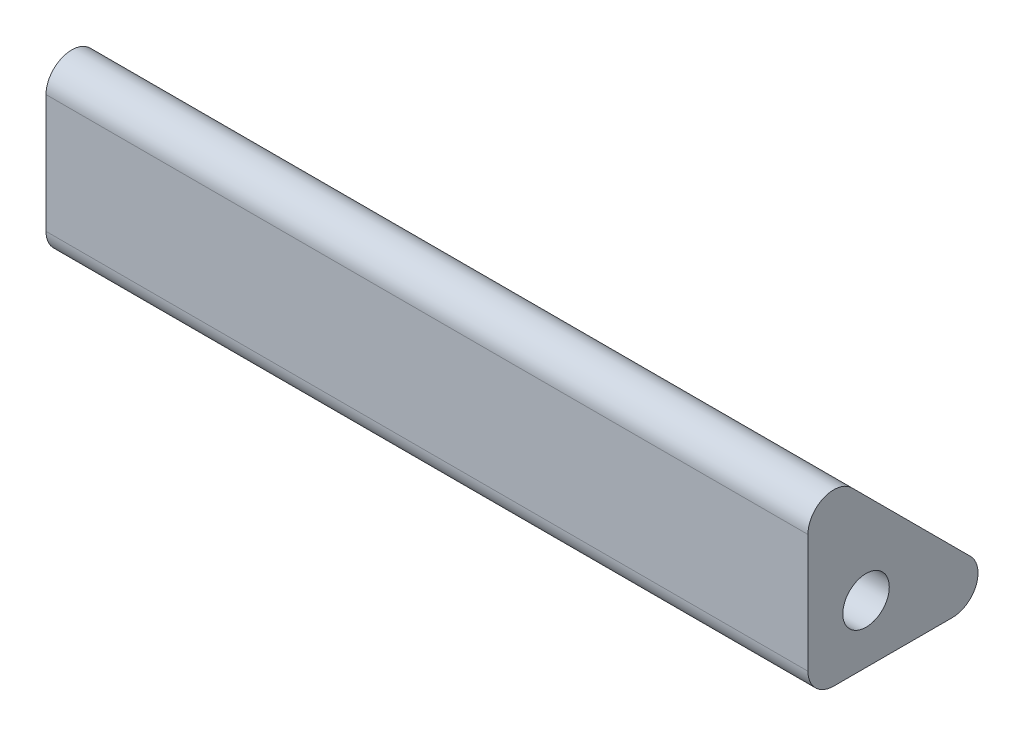
from build123d import *

# Parameters (mm, degrees)
SKETCH1_R           = 0.9
BOSS_EXTRUDE1_DEPTH = 29.5
FILLET1_R           = 1


with BuildPart() as part:
    # Sketch1 → Boss-Extrude1 (new body)
    with BuildSketch(Plane(origin=(0, 0, 0), x_dir=(0, 0, -1), z_dir=(1, 0, 0))):
        Polygon((-2.25, 5.75), (-2.25, -2.25), (5.75, -2.25), align=None)
        Circle(SKETCH1_R, mode=Mode.SUBTRACT)
    extrude(amount=BOSS_EXTRUDE1_DEPTH)

    # Fillet1
    fillet1_edges = [part.edges().sort_by_distance(p)[0] for p in [
        (14.75, -2.25, 2.25),
        (14.75, -2.25, -5.75),
        (14.75, 5.75, 2.25),
    ]]
    fillet(fillet1_edges, radius=FILLET1_R)


solid = part.part
